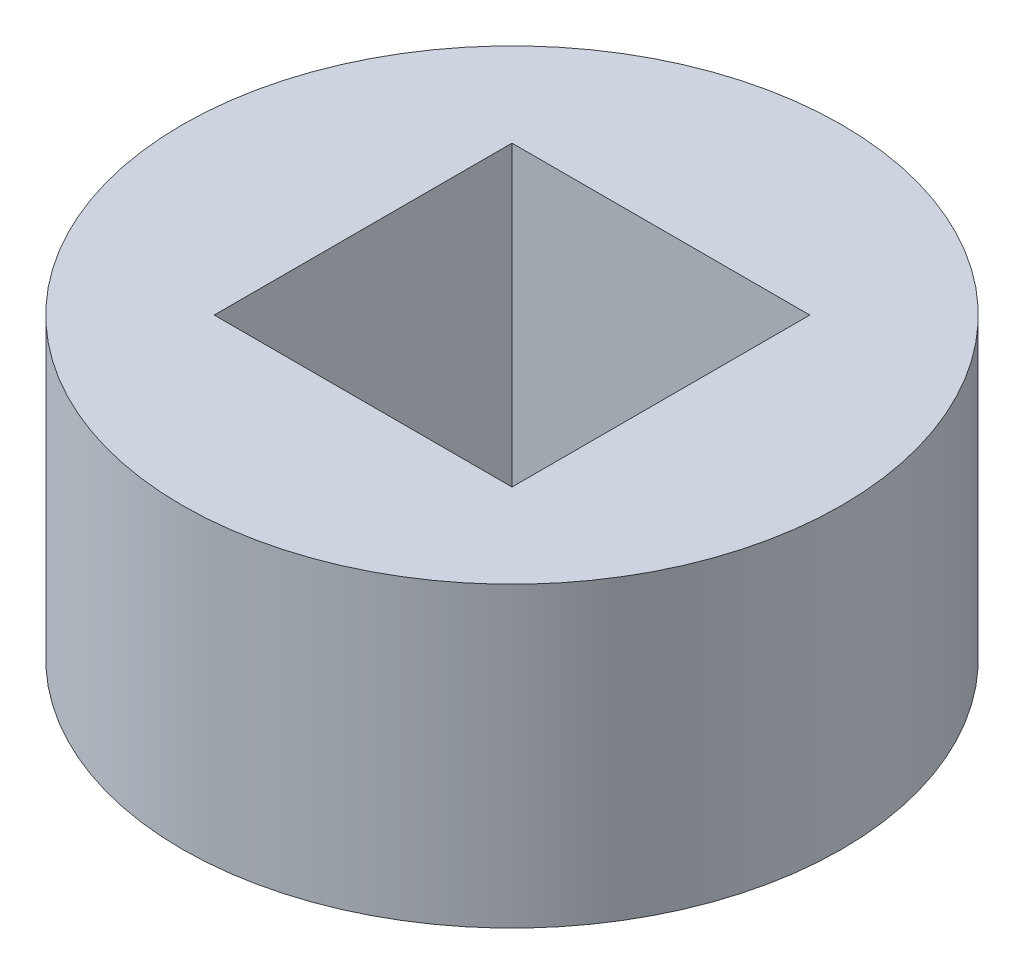
from build123d import *

# Parameters (mm, degrees)
ELEVATOR_AXLE_BEARING_R = 7.030128061
ELEVATOR_AXLE_BEARING_W = 6.35
ELEVATOR_AXLE_BEARING_H = 6.35
BOSS_EXTRUDE1_DEPTH     = 6.35


with BuildPart() as part:
    # Elevator Axle Bearing → Boss-Extrude1 (new body)
    with BuildSketch(Plane(origin=(0, 0, 0), x_dir=(1, 0, 0), z_dir=(0, 1, 0))):
        Circle(ELEVATOR_AXLE_BEARING_R)
        Rectangle(ELEVATOR_AXLE_BEARING_W, ELEVATOR_AXLE_BEARING_H, mode=Mode.SUBTRACT)
    extrude(amount=BOSS_EXTRUDE1_DEPTH)


solid = part.part
